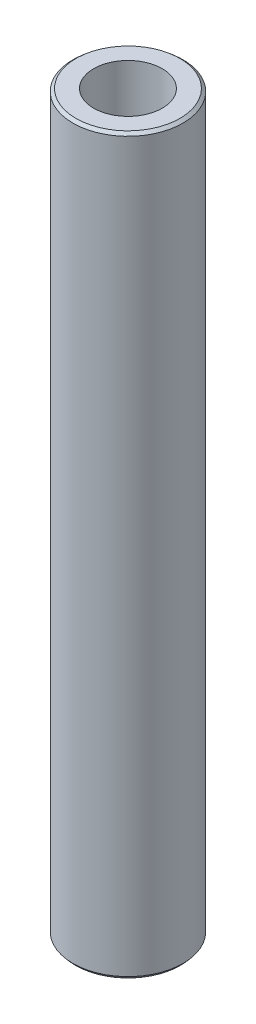
from build123d import *
from OCP.BRepFilletAPI import BRepFilletAPI_MakeChamfer

# Parameters (mm, degrees)
SKETCH1_R           = 45
BOSS_EXTRUDE1_DEPTH = 600
SKETCH2_R           = 28.052780193
CUT_EXTRUDE1_DEPTH  = 604.365560834
CHAMFER1_SIZE       = 2.114929102
CHAMFER1_SIZE2      = 2.48578024


with BuildPart() as part:
    # Sketch1 → Boss-Extrude1 (new body)
    with BuildSketch(Plane(origin=(0, 0, 0), x_dir=(1, 0, 0), z_dir=(0, 1, 0))):
        Circle(SKETCH1_R)
    extrude(amount=BOSS_EXTRUDE1_DEPTH)

    # Sketch2 → Cut-Extrude1 (cut, through all)
    with BuildSketch(Plane(origin=(0, 0, 0), x_dir=(1, 0, 0), z_dir=(0, 1, 0))):
        Circle(SKETCH2_R)
    extrude(amount=CUT_EXTRUDE1_DEPTH, mode=Mode.SUBTRACT)

    # Chamfer1: one chamfer whose edges measure the first distance from different faces: ONE call of the kernel's chamfer builder (chamfer() names one face for all edges)
    chamfer1_edges_1 = [part.edges().sort_by_distance(p)[0] for p in [
        (-45, 600, 0),
    ]]
    chamfer1_side_1 = [part.faces().sort_by_distance(p)[0] for p in [
        (-45, 300, 0),
    ]]
    chamfer1_edges_2 = [part.edges().sort_by_distance(p)[0] for p in [
        (-45, 0, 0),
    ]]
    chamfer1_side_2 = [part.faces().sort_by_distance(p)[0] for p in [
        (-43.727207794, 0, 0),
    ]]
    chamfer1 = BRepFilletAPI_MakeChamfer(part.part.solid().wrapped)
    for e in chamfer1_edges_1:
        chamfer1.Add(CHAMFER1_SIZE, CHAMFER1_SIZE2, e.wrapped, chamfer1_side_1[0].wrapped)  # the first distance lies on this face
    for e in chamfer1_edges_2:
        chamfer1.Add(CHAMFER1_SIZE, CHAMFER1_SIZE2, e.wrapped, chamfer1_side_2[0].wrapped)  # the first distance lies on this face
    add(Compound.cast(chamfer1.Shape()), mode=Mode.REPLACE)


solid = part.part
